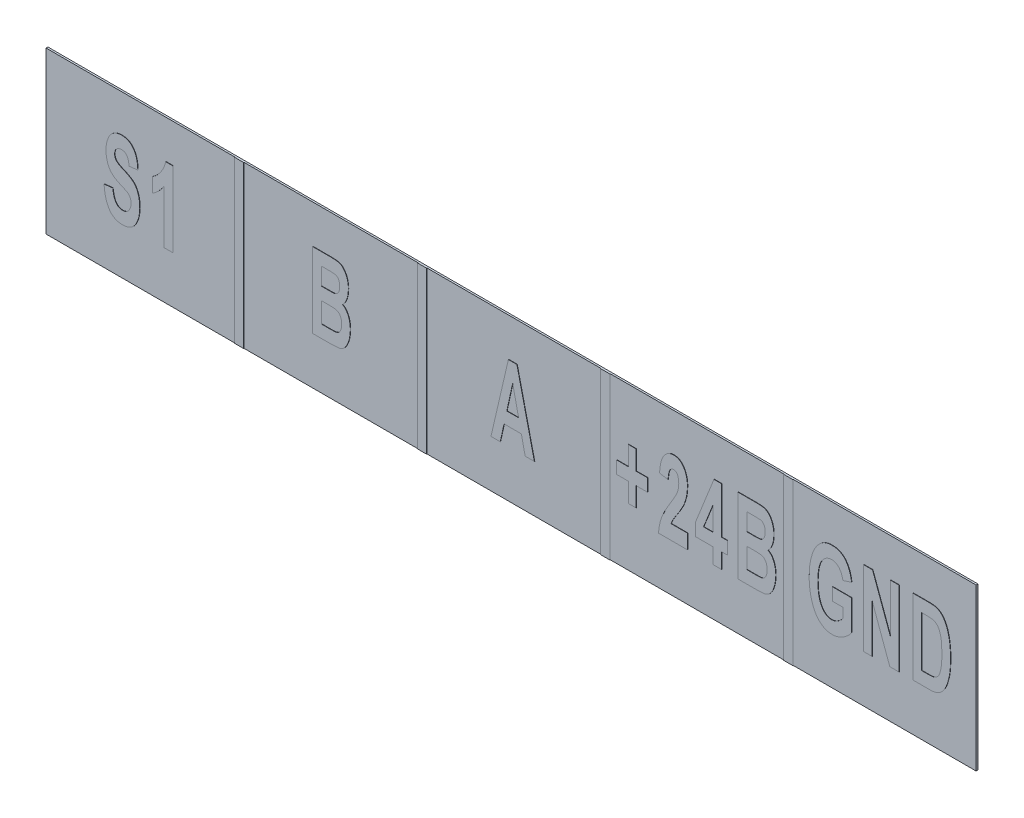
from build123d import *

# Parameters (mm, degrees)
SKETCH_1_W          = 25.4
SKETCH_1_H          = 4.4
EXTRUDE_1_DEPTH     = 0.05
EXTRUDE_START       = 0.05
EXTRUDE_3_OUTLINE_W = 0.25
EXTRUDE_3_OUTLINE_H = 4.4
EXTRUDE_3_DEPTH     = 0.01


# Read off the part's stored shape, not the designer's step: Вытянуть3
with BuildPart() as part:
    # Эскиз1 → Вытянуть1 (new body)
    with BuildSketch(Plane.XY):
        Rectangle(SKETCH_1_W, SKETCH_1_H)
    extrude(amount=EXTRUDE_1_DEPTH)

    # Вытянуть3 outline → Вытянуть3 (add)
    # profile 1 of 15: a face of its own
    with BuildSketch(Plane.XY.offset(EXTRUDE_START)):
        with BuildLine():
            add(Edge.make_bspline(
                [(-10.60971898, -0.92634173), (-10.628141935, -0.925829556), (-10.664103002, -0.924829808), (-10.716275842, -0.915836133), (-10.765314847, -0.902033064), (-10.811009529, -0.882090811), (-10.853366052, -0.856338641), (-10.892366385, -0.824740806), (-10.927796173, -0.787350875), (-10.960174583, -0.744602997), (-10.988703237, -0.696153331), (-11.014688087, -0.642754346), (-11.037904626, -0.584244003), (-11.056681607, -0.520130129), (-11.073905658, -0.451299925), (-11.087047258, -0.377132168), (-11.098049427, -0.297936445), (-11.102273788, -0.243271097), (-11.104449599, -0.215115017)],
                knots=[0, 0, 0, 0, 0.057155361, 0.111565592, 0.163872745, 0.214994054, 0.265837779, 0.317326872, 0.370350595, 0.425384155, 0.483459049, 0.544609463, 0.609628177, 0.678619213, 0.751865577, 0.829814748, 0.912343931, 1, 1, 1, 1], degree=3))
            add(Edge.make_bspline(
                [(-10.129805585, -0.296198155), (-10.130513437, -0.325045668), (-10.131907163, -0.381844994), (-10.143093873, -0.465690859), (-10.160445613, -0.54681221), (-10.185415197, -0.624018094), (-10.216181873, -0.695133324), (-10.254065021, -0.757520053), (-10.297617751, -0.81045315), (-10.347950904, -0.85333532), (-10.40448026, -0.886242611), (-10.467155779, -0.909887412), (-10.536370758, -0.924090656), (-10.584679706, -0.925573269), (-10.60971898, -0.92634173)],
                knots=[0, 0, 0, 0, 0.096838906, 0.190671015, 0.283568747, 0.375066741, 0.462729751, 0.543166375, 0.619379511, 0.691938791, 0.764001999, 0.837930566, 0.915996908, 1, 1, 1, 1], degree=3))
            add(Edge.make_bspline(
                [(-10.779293868, 0.51874912), (-10.77503929, 0.513275717), (-10.765893229, 0.50150955), (-10.748211785, 0.485372071), (-10.727234263, 0.468333121), (-10.701925465, 0.45156835), (-10.67252568, 0.434767289), (-10.639203661, 0.417660561), (-10.602154738, 0.399749555), (-10.548582165, 0.377399735), (-10.48374803, 0.349477256), (-10.414020494, 0.312832835), (-10.355144175, 0.276165261), (-10.306215425, 0.237790096), (-10.265590071, 0.19487735), (-10.230671352, 0.146106573), (-10.200463926, 0.090182725), (-10.175120504, 0.027348815), (-10.154399316, -0.042736109), (-10.139875416, -0.12035534), (-10.131285864, -0.205728213), (-10.130313262, -0.265170555), (-10.129805585, -0.296198155)],
                knots=[0, 0, 0, 0, 0.018347505, 0.03944161, 0.063240486, 0.08997119, 0.119789455, 0.152973188, 0.189249474, 0.228838423, 0.306828834, 0.376294856, 0.437438304, 0.490488661, 0.540653041, 0.593543584, 0.649040805, 0.708743837, 0.772841298, 0.842457583, 0.917766311, 1, 1, 1, 1], degree=3))
            add(Edge.make_bspline(
                [(-10.814690567, 0.640991211), (-10.814426411, 0.629413373), (-10.813914718, 0.606986141), (-10.806214605, 0.575034583), (-10.796092947, 0.544982473), (-10.784885686, 0.527481274), (-10.779293868, 0.51874912)],
                knots=[0, 0, 0, 0, 0.268069174, 0.51927224, 0.760142774, 1, 1, 1, 1], degree=3))
            add(Edge.make_bspline(
                [(-10.778882278, 0.765702839), (-10.78446552, 0.757528534), (-10.795949946, 0.74071443), (-10.80654279, 0.710632004), (-10.813904192, 0.677162152), (-10.814421094, 0.653386193), (-10.814690567, 0.640991211)],
                knots=[0, 0, 0, 0, 0.224074753, 0.460909636, 0.718959152, 1, 1, 1, 1], degree=3))
            add(Edge.make_bspline(
                [(-10.624947793, 0.838554187), (-10.64056431, 0.837767146), (-10.670665341, 0.836250116), (-10.713137808, 0.82216179), (-10.750184169, 0.798641784), (-10.769215793, 0.77679778), (-10.778882278, 0.765702839)],
                knots=[0, 0, 0, 0, 0.264588127, 0.5099969, 0.751119118, 1, 1, 1, 1], degree=3))
            add(Edge.make_bspline(
                [(-10.419564616, 0.548795156), (-10.422340104, 0.572721197), (-10.427510074, 0.617288838), (-10.440246653, 0.678708025), (-10.457510795, 0.729470787), (-10.479412307, 0.770230048), (-10.507120983, 0.801512196), (-10.541085416, 0.823430642), (-10.581207182, 0.836661264), (-10.60988702, 0.837902415), (-10.624947793, 0.838554187)],
                knots=[0, 0, 0, 0, 0.181704909, 0.338466312, 0.472385547, 0.585007184, 0.685428934, 0.784209652, 0.886681038, 1, 1, 1, 1], degree=3))
            Line((-10.419564616, 0.548795156), (-10.182489045, 0.575136886))
            add(Edge.make_bspline(
                [(-10.62782892, 1.180996678), (-10.610097651, 1.180596179), (-10.575684744, 1.17981889), (-10.525860144, 1.171690202), (-10.479248448, 1.158996696), (-10.435857294, 1.141094531), (-10.396291369, 1.117030472), (-10.359860838, 1.088526523), (-10.326561743, 1.054963946), (-10.297587598, 1.015954016), (-10.271759821, 0.972918162), (-10.248491285, 0.926415005), (-10.229488057, 0.87608601), (-10.21321786, 0.822630778), (-10.200725037, 0.765607982), (-10.190702187, 0.705198833), (-10.184621665, 0.641243967), (-10.18321087, 0.597512064), (-10.182489045, 0.575136886)],
                knots=[0, 0, 0, 0, 0.062767438, 0.121819264, 0.178302912, 0.233637247, 0.287485113, 0.341837334, 0.397171669, 0.454427963, 0.513527776, 0.574825207, 0.638370676, 0.703873085, 0.772618656, 0.845013086, 0.920701833, 1, 1, 1, 1], degree=3))
            add(Edge.make_bspline(
                [(-11.051766138, 0.613414712), (-11.051129259, 0.638964196), (-11.049874999, 0.689280868), (-11.040047297, 0.763504672), (-11.024554538, 0.835160577), (-11.002960568, 0.90363847), (-10.975644982, 0.967102488), (-10.941768538, 1.023263893), (-10.902260157, 1.071268908), (-10.857559801, 1.111435052), (-10.807053903, 1.142634059), (-10.751704765, 1.165028974), (-10.691306432, 1.178536392), (-10.64943995, 1.180159069), (-10.62782892, 1.180996678)],
                knots=[0, 0, 0, 0, 0.096380759, 0.189810457, 0.282012948, 0.372717922, 0.46034348, 0.542115107, 0.619337112, 0.694143952, 0.767842695, 0.842155281, 0.918522242, 1, 1, 1, 1], degree=3))
            add(Edge.make_bspline(
                [(-10.942283323, 0.203883127), (-10.951028151, 0.218155572), (-10.96856093, 0.246770839), (-10.990696053, 0.292418033), (-11.009869645, 0.340200295), (-11.024670834, 0.390628225), (-11.037574276, 0.44296579), (-11.045156827, 0.497871311), (-11.051039218, 0.554842236), (-11.05152074, 0.593641443), (-11.051766138, 0.613414712)],
                knots=[0, 0, 0, 0, 0.116753437, 0.234082586, 0.353564175, 0.475630413, 0.600576703, 0.729353041, 0.862069989, 1, 1, 1, 1], degree=3))
            add(Edge.make_bspline(
                [(-10.670634231, 0.002204256), (-10.68624526, 0.008977642), (-10.716670494, 0.022178683), (-10.759357867, 0.045205461), (-10.799092171, 0.068350276), (-10.834823716, 0.093185643), (-10.867433529, 0.118576633), (-10.895617659, 0.146022254), (-10.921246498, 0.173784243), (-10.935358787, 0.1939757), (-10.942283323, 0.203883127)],
                knots=[0, 0, 0, 0, 0.148753206, 0.289913688, 0.423873812, 0.550678861, 0.670231807, 0.784797709, 0.894405789, 1, 1, 1, 1], degree=3))
            add(Edge.make_bspline(
                [(-10.47801033, -0.087110673), (-10.482098293, -0.08472591), (-10.491223056, -0.07940287), (-10.507141466, -0.071830077), (-10.525941918, -0.062242603), (-10.548193943, -0.051419027), (-10.574268073, -0.040237287), (-10.603244706, -0.026785906), (-10.635996506, -0.01305456), (-10.658714548, -0.003046673), (-10.670634231, 0.002204256)],
                knots=[0, 0, 0, 0, 0.066813334, 0.149134369, 0.248786147, 0.364915066, 0.498499582, 0.649399019, 0.816046988, 1, 1, 1, 1], degree=3))
            add(Edge.make_bspline(
                [(-10.366881156, -0.300314051), (-10.367220552, -0.288640386), (-10.367878079, -0.266024518), (-10.372255268, -0.233388688), (-10.380177061, -0.203609722), (-10.390773736, -0.176031561), (-10.406188413, -0.151037782), (-10.42509658, -0.127034234), (-10.449816614, -0.105857831), (-10.468406423, -0.093496704), (-10.47801033, -0.087110673)],
                knots=[0, 0, 0, 0, 0.138309456, 0.267952563, 0.388985445, 0.502773048, 0.616502594, 0.735554804, 0.863381761, 1, 1, 1, 1], degree=3))
            add(Edge.make_bspline(
                [(-10.603956727, -0.583899239), (-10.594470906, -0.583718321), (-10.575952569, -0.583365133), (-10.549095949, -0.578975814), (-10.523815941, -0.572703651), (-10.500778892, -0.562971371), (-10.479101207, -0.551385433), (-10.459559906, -0.536520336), (-10.441673466, -0.519136082), (-10.420837161, -0.492417497), (-10.399593751, -0.455187878), (-10.380161763, -0.406970254), (-10.368901475, -0.3547461), (-10.367565498, -0.31875182), (-10.366881156, -0.300314051)],
                knots=[0, 0, 0, 0, 0.068384962, 0.133501975, 0.195944322, 0.255887312, 0.313495041, 0.3729041, 0.432420328, 0.493038273, 0.616838825, 0.740397606, 0.867020844, 1, 1, 1, 1], degree=3))
            add(Edge.make_bspline(
                [(-10.867374028, -0.188773287), (-10.865446825, -0.205254838), (-10.861727618, -0.237061708), (-10.854214471, -0.282903591), (-10.845791381, -0.325421842), (-10.835437086, -0.364538178), (-10.823969207, -0.400423465), (-10.811344877, -0.433148247), (-10.797011672, -0.462346193), (-10.78130075, -0.488116659), (-10.764300562, -0.510687947), (-10.745695456, -0.530227035), (-10.725427767, -0.546689826), (-10.704004108, -0.560496736), (-10.680947017, -0.570895511), (-10.656587403, -0.578234527), (-10.630750738, -0.582935956), (-10.613032314, -0.583572959), (-10.603956727, -0.583899239)],
                knots=[0, 0, 0, 0, 0.094941404, 0.183222381, 0.265748011, 0.342868784, 0.414619948, 0.481244495, 0.543389025, 0.600478157, 0.653706747, 0.704790541, 0.754448857, 0.802799152, 0.850229264, 0.898655983, 0.948090387, 1, 1, 1, 1], degree=3))
            Line((-10.867374028, -0.188773287), (-11.104449599, -0.215115017))
        make_face()
    # profile 2 of 15: a face of its own
    with BuildSketch(Plane.XY.offset(EXTRUDE_START)):
        with BuildLine():
            add(Edge.make_bspline(
                [(-9.779460574, 0.627820346), (-9.763118314, 0.637840247), (-9.727908667, 0.659428277), (-9.677822987, 0.703228822), (-9.625359182, 0.757683125), (-9.57212639, 0.822249295), (-9.521375014, 0.895340583), (-9.478881734, 0.976169038), (-9.445062086, 1.062930173), (-9.429909929, 1.123724295), (-9.42220086, 1.154654948)],
                knots=[0, 0, 0, 0, 0.087928692, 0.189443698, 0.304433758, 0.435158803, 0.573433564, 0.712420315, 0.853686061, 1, 1, 1, 1], degree=3))
            Line((-9.779460574, 0.627820346), (-9.779460574, 0.232694394))
            add(Edge.make_bspline(
                [(-9.463359813, 0.5627892), (-9.474535942, 0.544677481), (-9.49651076, 0.50906571), (-9.532618667, 0.45880128), (-9.569788617, 0.411915344), (-9.608790578, 0.36884633), (-9.648994626, 0.329312983), (-9.690852526, 0.293390024), (-9.733791137, 0.260484563), (-9.764331106, 0.24190078), (-9.779460574, 0.232694394)],
                knots=[0, 0, 0, 0, 0.138234037, 0.271799642, 0.401820386, 0.526777454, 0.649060785, 0.767883963, 0.885009964, 1, 1, 1, 1], degree=3))
            Line((-9.463359813, 0.5627892), (-9.463359813, -0.9))
            Line((-9.463359813, -0.9), (-9.226284242, -0.9))
            Line((-9.226284242, -0.9), (-9.226284242, 1.154654948))
            Line((-9.226284242, 1.154654948), (-9.42220086, 1.154654948))
        make_face()
    # profile 3 of 15: a face of its own
    with BuildSketch(Plane.XY.offset(EXTRUDE_START)):
        with BuildLine():
            add(Edge.make_bspline(
                [(8.761184819, -0.583899239), (8.775104898, -0.583268092), (8.803287987, -0.581990248), (8.845282993, -0.57124279), (8.887631799, -0.555474284), (8.928578399, -0.531876036), (8.968617762, -0.50476919), (9.005718739, -0.473793222), (9.040636409, -0.440812544), (9.060924159, -0.416329084), (9.071111737, -0.404034613)],
                knots=[0, 0, 0, 0, 0.112823504, 0.22842649, 0.350030893, 0.478633326, 0.610830397, 0.742147478, 0.870518282, 1, 1, 1, 1], degree=3))
            add(Edge.make_bspline(
                [(8.386226754, 0.151199667), (8.386508621, 0.121556291), (8.387055808, 0.064009784), (8.392226937, -0.019317988), (8.399556411, -0.097013127), (8.411331865, -0.168804981), (8.425404245, -0.235160828), (8.442942439, -0.29577254), (8.463953242, -0.350623148), (8.48825698, -0.399560319), (8.514737868, -0.443154299), (8.544369422, -0.480274367), (8.574987194, -0.512534277), (8.608471564, -0.538280531), (8.643632949, -0.558852607), (8.68101811, -0.573252105), (8.720413552, -0.582362762), (8.74741456, -0.583380303), (8.761184819, -0.583899239)],
                knots=[0, 0, 0, 0, 0.097537687, 0.18934933, 0.274661063, 0.35423026, 0.428617281, 0.497766892, 0.561656542, 0.621624347, 0.67737875, 0.729134482, 0.777664497, 0.823360586, 0.867656858, 0.911255069, 0.954740925, 1, 1, 1, 1], degree=3))
            add(Edge.make_bspline(
                [(8.771062968, 0.838554187), (8.756762031, 0.837946197), (8.728630553, 0.836750217), (8.687391334, 0.828894902), (8.648469935, 0.815186866), (8.611885663, 0.796049544), (8.577656526, 0.771380715), (8.546124332, 0.740976619), (8.516129473, 0.705774599), (8.489066654, 0.664810674), (8.464972309, 0.618506289), (8.443297506, 0.567302293), (8.426031313, 0.510486194), (8.411024881, 0.44884694), (8.400311079, 0.38178079), (8.392027859, 0.309696053), (8.387105387, 0.232213668), (8.38652591, 0.178783209), (8.386226754, 0.151199667)],
                knots=[0, 0, 0, 0, 0.048933012, 0.096256492, 0.143024873, 0.189639857, 0.237063355, 0.286873488, 0.339167922, 0.395024291, 0.454451604, 0.51757441, 0.58498224, 0.657398995, 0.734498521, 0.817186613, 0.905622359, 1, 1, 1, 1], degree=3))
            add(Edge.make_bspline(
                [(9.071111737, 0.496111695), (9.065943949, 0.521372414), (9.056049373, 0.569738194), (9.03233948, 0.637084091), (9.002795594, 0.696269519), (8.972555693, 0.739011426), (8.945650208, 0.768400293), (8.924438709, 0.787196344), (8.901894109, 0.803272404), (8.877897162, 0.815736567), (8.853169657, 0.826493107), (8.826753896, 0.833186435), (8.7993714, 0.838087161), (8.780552616, 0.838397629), (8.771062968, 0.838554187)],
                knots=[0, 0, 0, 0, 0.155460721, 0.297654997, 0.429478997, 0.55354701, 0.612141232, 0.669625123, 0.724297239, 0.778749472, 0.832568518, 0.886597336, 0.942815039, 1, 1, 1, 1], degree=3))
            Line((9.071111737, 0.496111695), (9.308187308, 0.575136886))
            add(Edge.make_bspline(
                [(8.773120915, 1.180996678), (8.792076726, 1.180532815), (8.82917875, 1.179624901), (8.883304899, 1.17222391), (8.934206479, 1.159422445), (8.981882928, 1.141701976), (9.026254016, 1.118934983), (9.067296077, 1.091155051), (9.105138821, 1.058252462), (9.139520981, 1.020332797), (9.170821248, 0.977905562), (9.199689593, 0.931931786), (9.22522448, 0.881716108), (9.247774512, 0.827740136), (9.267470753, 0.769966212), (9.284406968, 0.708566182), (9.297880593, 0.643201913), (9.304691845, 0.598220749), (9.308187308, 0.575136886)],
                knots=[0, 0, 0, 0, 0.06346924, 0.124227724, 0.182512098, 0.23892629, 0.294206336, 0.349133886, 0.404505518, 0.4617482, 0.520195354, 0.580882562, 0.643354336, 0.708637207, 0.776641421, 0.847649778, 0.921815458, 1, 1, 1, 1], degree=3))
            add(Edge.make_bspline(
                [(8.472248967, 1.079334063), (8.482521077, 1.087508079), (8.502929536, 1.103748078), (8.536325849, 1.124280909), (8.571131181, 1.142185905), (8.608129368, 1.156019186), (8.646642574, 1.167202695), (8.687058846, 1.175614587), (8.729534355, 1.179937954), (8.758432522, 1.180639895), (8.773120915, 1.180996678)],
                knots=[0, 0, 0, 0, 0.121324888, 0.241046293, 0.361932344, 0.482838376, 0.605732726, 0.73266254, 0.864117405, 1, 1, 1, 1], degree=3))
            add(Edge.make_bspline(
                [(8.149151184, 0.134324496), (8.149327859, 0.160536496), (8.14967589, 0.212171011), (8.154238354, 0.288461858), (8.159973411, 0.362517194), (8.169282109, 0.434284015), (8.180545297, 0.503974176), (8.195194988, 0.571289123), (8.211411502, 0.636655158), (8.230803307, 0.699384964), (8.252344923, 0.75940322), (8.276837652, 0.815885795), (8.302983317, 0.869122455), (8.331707377, 0.918607541), (8.363246007, 0.964174692), (8.397098783, 1.006236764), (8.432977668, 1.045118904), (8.459277353, 1.068032531), (8.472248967, 1.079334063)],
                knots=[0, 0, 0, 0, 0.076396793, 0.150492572, 0.222730197, 0.292872716, 0.361382919, 0.4284491, 0.493632188, 0.557644101, 0.61976273, 0.679418602, 0.73701047, 0.79257106, 0.846042683, 0.898383624, 0.94988045, 1, 1, 1, 1], degree=3))
            add(Edge.make_bspline(
                [(8.77805999, -0.92634173), (8.762125935, -0.925951608), (8.730684312, -0.925181807), (8.684199397, -0.91888923), (8.639278321, -0.908177924), (8.595970445, -0.893184579), (8.55400501, -0.874750815), (8.513829675, -0.851394397), (8.475332906, -0.82371739), (8.438054785, -0.792459319), (8.403143922, -0.756861373), (8.370267901, -0.717781996), (8.339592369, -0.675200664), (8.311762828, -0.628695391), (8.285249252, -0.579008455), (8.261538213, -0.525428467), (8.240132776, -0.468347155), (8.214265616, -0.387105587), (8.188087726, -0.28017598), (8.165552418, -0.146888144), (8.151630091, -0.008107162), (8.149987482, 0.086272948), (8.149151184, 0.134324496)],
                knots=[0, 0, 0, 0, 0.034900339, 0.068866545, 0.102549606, 0.13591464, 0.169150796, 0.202817758, 0.237515579, 0.272923526, 0.309269569, 0.346601563, 0.384723865, 0.424108648, 0.465253795, 0.508042701, 0.552370714, 0.598760379, 0.694773461, 0.79326019, 0.894742991, 1, 1, 1, 1], degree=3))
            add(Edge.make_bspline(
                [(9.308187308, -0.618884349), (9.294180927, -0.639074822), (9.26565874, -0.680190116), (9.211538631, -0.735106932), (9.150265715, -0.787756619), (9.080956063, -0.834905768), (9.007383506, -0.874918008), (8.931714933, -0.904908488), (8.855045491, -0.922874886), (8.803530597, -0.925194727), (8.77805999, -0.92634173)],
                knots=[0, 0, 0, 0, 0.115778008, 0.235766976, 0.362535251, 0.496694809, 0.630538361, 0.757033491, 0.879869603, 1, 1, 1, 1], degree=3))
            Line((9.308187308, -0.618884349), (9.308187308, 0.206352664))
            Line((9.308187308, 0.206352664), (8.781352706, 0.206352664))
            Line((8.781352706, 0.206352664), (8.781352706, -0.136089827))
            Line((8.781352706, -0.136089827), (9.071111737, -0.136089827))
            Line((9.071111737, -0.136089827), (9.071111737, -0.404034613))
        make_face()
    # profile 4 of 15: a face of its own
    with BuildSketch(Plane.XY.offset(EXTRUDE_START)):
        with BuildLine():
            add(Edge.make_bspline(
                [(11.667994736, -0.85637151), (11.653345761, -0.863138566), (11.622684126, -0.877302629), (11.5706254, -0.890241871), (11.512135344, -0.898484542), (11.470739604, -0.899478636), (11.449029104, -0.9)],
                knots=[0, 0, 0, 0, 0.214501474, 0.448971073, 0.711006174, 1, 1, 1, 1], degree=3))
            add(Edge.make_bspline(
                [(11.842097108, -0.692558875), (11.830870392, -0.709354832), (11.808514727, -0.742800479), (11.767285175, -0.78696782), (11.720373763, -0.825360958), (11.685572702, -0.845964626), (11.667994736, -0.85637151)],
                knots=[0, 0, 0, 0, 0.25040702, 0.498633385, 0.74676044, 1, 1, 1, 1], degree=3))
            add(Edge.make_bspline(
                [(11.973394169, -0.329536907), (11.965435186, -0.365217243), (11.950141686, -0.433778418), (11.919448895, -0.52998845), (11.885307414, -0.616453743), (11.856114801, -0.667869895), (11.842097108, -0.692558875)],
                knots=[0, 0, 0, 0, 0.282649147, 0.54312151, 0.780616334, 1, 1, 1, 1], degree=3))
            add(Edge.make_bspline(
                [(12.010848816, 0.107571176), (12.010391504, 0.066810742), (12.009508497, -0.01189212), (12.002308273, -0.125582891), (11.991583246, -0.230827412), (11.979298527, -0.297494809), (11.973394169, -0.329536907)],
                knots=[0, 0, 0, 0, 0.278274174, 0.537309619, 0.777618872, 1, 1, 1, 1], degree=3))
            add(Edge.make_bspline(
                [(11.668817915, 1.115553942), (11.686537925, 1.10561153), (11.722963515, 1.085173717), (11.770886201, 1.041301084), (11.815930185, 0.98860275), (11.855570669, 0.925193086), (11.891676588, 0.853512177), (11.923349087, 0.77376709), (11.949776897, 0.686244612), (11.967961188, 0.608284587), (11.980417295, 0.541805963), (11.988605886, 0.488264693), (11.995526751, 0.431848564), (12.001441603, 0.372579128), (12.005188351, 0.310369241), (12.008813804, 0.2453541), (12.010152301, 0.177409031), (12.010613469, 0.131168878), (12.010848816, 0.107571176)],
                knots=[0, 0, 0, 0, 0.054716942, 0.112477188, 0.174252007, 0.241578543, 0.313830535, 0.390827753, 0.472993245, 0.560536587, 0.606903899, 0.6556418, 0.706796134, 0.760406544, 0.816481765, 0.875103254, 0.936261539, 1, 1, 1, 1], degree=3))
            add(Edge.make_bspline(
                [(11.435858239, 1.154654948), (11.459901865, 1.154288109), (11.50496267, 1.153600608), (11.567938514, 1.145857564), (11.62253296, 1.135328538), (11.654160834, 1.121815974), (11.668817915, 1.115553942)],
                knots=[0, 0, 0, 0, 0.302833063, 0.567547568, 0.799591657, 1, 1, 1, 1], degree=3))
            Line((11.435858239, 1.154654948), (10.983521342, 1.154654948))
            Line((10.983521342, 1.154654948), (10.983521342, -0.9))
            Line((10.983521342, -0.9), (11.449029104, -0.9))
        make_face()
        with BuildLine():
            add(Edge.make_bspline(
                [(11.415690352, -0.557557509), (11.432714902, -0.557372275), (11.464204028, -0.557029662), (11.507502641, -0.553349489), (11.543432278, -0.547899122), (11.564063502, -0.540930757), (11.573329143, -0.537801211)],
                knots=[0, 0, 0, 0, 0.319773085, 0.591462045, 0.816522471, 1, 1, 1, 1], degree=3))
            Line((11.415690352, -0.557557509), (11.220596913, -0.557557509))
            Line((11.220596913, -0.557557509), (11.220596913, 0.812212457))
            Line((11.220596913, 0.812212457), (11.33789993, 0.812212457))
            add(Edge.make_bspline(
                [(11.552338077, 0.792456159), (11.547280765, 0.794032784), (11.536183884, 0.797492255), (11.517484535, 0.801578937), (11.495441659, 0.804566201), (11.470216332, 0.807629908), (11.441770524, 0.809427473), (11.410086089, 0.811234592), (11.375082145, 0.811870862), (11.350659002, 0.812095238), (11.33789993, 0.812212457)],
                knots=[0, 0, 0, 0, 0.073524573, 0.161329492, 0.265308941, 0.382261587, 0.514034373, 0.660898358, 0.82284744, 1, 1, 1, 1], degree=3))
            add(Edge.make_bspline(
                [(11.773773246, 0.126504295), (11.77369986, 0.14598694), (11.773557724, 0.183721603), (11.7723093, 0.238470592), (11.770303642, 0.289657229), (11.767384103, 0.337406321), (11.763963915, 0.381781912), (11.758731005, 0.422616923), (11.753666669, 0.460011822), (11.745521928, 0.504057768), (11.733820689, 0.553781782), (11.716857913, 0.607555227), (11.697098191, 0.654430009), (11.674471057, 0.694257033), (11.648989945, 0.728188595), (11.620120101, 0.755860603), (11.587942627, 0.778088237), (11.564214489, 0.787663531), (11.552338077, 0.792456159)],
                knots=[0, 0, 0, 0, 0.07874111, 0.152508516, 0.221322528, 0.285761665, 0.345855363, 0.401152776, 0.45212467, 0.49834825, 0.582138486, 0.658420186, 0.725987461, 0.787336938, 0.843121513, 0.896850925, 0.948371808, 1, 1, 1, 1], degree=3))
            add(Edge.make_bspline(
                [(11.573329143, -0.537801211), (11.583644933, -0.53317102), (11.604322868, -0.523889831), (11.632498515, -0.504306385), (11.657289365, -0.479880469), (11.68039435, -0.451074788), (11.70110122, -0.414742051), (11.718566359, -0.369123047), (11.734494234, -0.314027322), (11.74550808, -0.261835715), (11.753621496, -0.214947298), (11.758729202, -0.175368091), (11.763905419, -0.132742668), (11.767392215, -0.086867464), (11.770287066, -0.038019026), (11.772303904, 0.013989401), (11.773554928, 0.069149885), (11.773699085, 0.107021671), (11.773773246, 0.126504295)],
                knots=[0, 0, 0, 0, 0.046372104, 0.092952592, 0.139977472, 0.188908462, 0.244195236, 0.310955801, 0.389057774, 0.479578964, 0.529882699, 0.584472997, 0.643466421, 0.706220821, 0.773393917, 0.844451518, 0.919980205, 1, 1, 1, 1], degree=3))
        make_face(mode=Mode.SUBTRACT)
    # profile 5 of 15: a face of its own
    with BuildSketch(Plane.XY.offset(EXTRUDE_START)):
        with BuildLine():
            add(Edge.make_bspline(
                [(4.710968825, 0.080406267), (4.707302139, 0.072568278), (4.699527532, 0.055949107), (4.686367217, 0.02992205), (4.670489922, 0.001796919), (4.653474881, -0.029470981), (4.632954106, -0.062364047), (4.611493184, -0.09842306), (4.586808451, -0.136230519), (4.561343021, -0.175774951), (4.535946737, -0.214867618), (4.512156788, -0.251235721), (4.49094048, -0.284164897), (4.473102347, -0.31400062), (4.456878332, -0.33965851), (4.44366267, -0.362081951), (4.432864499, -0.380969793), (4.417590111, -0.410184134), (4.398400827, -0.450531794), (4.385514197, -0.487056202), (4.379227661, -0.504874048)],
                knots=[0, 0, 0, 0, 0.038502239, 0.081637693, 0.129724339, 0.182198611, 0.239989059, 0.302177609, 0.368896169, 0.440859975, 0.511467207, 0.57631637, 0.634232425, 0.685742667, 0.730974039, 0.76929194, 0.801547998, 0.827762044, 0.915976475, 1, 1, 1, 1], degree=3))
            add(Edge.make_bspline(
                [(4.825802305, 0.595716362), (4.825530997, 0.573341532), (4.824994237, 0.529074709), (4.819359019, 0.463549008), (4.810817837, 0.399653151), (4.798757277, 0.336846575), (4.782984165, 0.274174823), (4.763002634, 0.210631712), (4.739285486, 0.145582019), (4.720525496, 0.102402618), (4.710968825, 0.080406267)],
                knots=[0, 0, 0, 0, 0.1261159, 0.249510287, 0.370495697, 0.489426299, 0.609864041, 0.7346326, 0.864817157, 1, 1, 1, 1], degree=3))
            add(Edge.make_bspline(
                [(4.452490598, 1.154654948), (4.466649496, 1.154180815), (4.49448214, 1.153248794), (4.535035078, 1.145910774), (4.572906475, 1.132732462), (4.608825141, 1.115448593), (4.642218081, 1.092678257), (4.673051223, 1.064545676), (4.701324422, 1.03152218), (4.727066521, 0.993958369), (4.750357024, 0.953082035), (4.770636084, 0.909302545), (4.787235206, 0.862877953), (4.80204389, 0.814408726), (4.812361918, 0.76308208), (4.820334226, 0.709524557), (4.82477907, 0.653413664), (4.825456675, 0.615205447), (4.825802305, 0.595716362)],
                knots=[0, 0, 0, 0, 0.056704136, 0.111465314, 0.1643007, 0.216901171, 0.270710877, 0.325574003, 0.383636199, 0.444465096, 0.507725717, 0.571905955, 0.637455252, 0.705099969, 0.774731586, 0.84693785, 0.92192671, 1, 1, 1, 1], degree=3))
            add(Edge.make_bspline(
                [(4.061892132, 0.534801111), (4.063863889, 0.561438254), (4.06767249, 0.612889935), (4.076806146, 0.687037363), (4.088002613, 0.75539772), (4.102422626, 0.817958526), (4.119528438, 0.874652565), (4.139158172, 0.925528199), (4.161424352, 0.970583115), (4.186564097, 1.00981822), (4.214116605, 1.043965001), (4.243121758, 1.073581485), (4.273865758, 1.098670511), (4.306384331, 1.119036571), (4.340418338, 1.135281658), (4.376507929, 1.146287761), (4.413905975, 1.15371743), (4.439557679, 1.154340708), (4.452490598, 1.154654948)],
                knots=[0, 0, 0, 0, 0.098731803, 0.190708037, 0.27609336, 0.354711731, 0.427875905, 0.494844219, 0.55608801, 0.613350504, 0.666739676, 0.718027581, 0.766347984, 0.813068672, 0.859582416, 0.905301234, 0.952255355, 1, 1, 1, 1], degree=3))
            Line((4.061892132, 0.534801111), (4.298967702, 0.496111695))
            add(Edge.make_bspline(
                [(4.447551524, 0.812212457), (4.437111578, 0.811356944), (4.416261709, 0.809648379), (4.386971597, 0.794997891), (4.362347111, 0.770609448), (4.345343678, 0.744177485), (4.333817608, 0.718570738), (4.325447784, 0.69579989), (4.318770338, 0.669815878), (4.312455986, 0.641023844), (4.307734291, 0.609098361), (4.303524368, 0.57425427), (4.300788099, 0.536202099), (4.299590804, 0.509834199), (4.298967702, 0.496111695)],
                knots=[0, 0, 0, 0, 0.081508014, 0.162781635, 0.250249408, 0.350457412, 0.407233293, 0.470161852, 0.54032682, 0.617304432, 0.701099631, 0.793127913, 0.892338682, 1, 1, 1, 1], degree=3))
            add(Edge.make_bspline(
                [(4.588726734, 0.542621313), (4.588290211, 0.563087322), (4.587469899, 0.601547028), (4.580527752, 0.655496237), (4.569443688, 0.702158567), (4.553246315, 0.74130269), (4.532521889, 0.772357321), (4.508452333, 0.796092695), (4.478913961, 0.809512117), (4.45809995, 0.811304226), (4.447551524, 0.812212457)],
                knots=[0, 0, 0, 0, 0.182319056, 0.342613796, 0.483762358, 0.608661945, 0.717852868, 0.814741715, 0.906112121, 1, 1, 1, 1], degree=3))
            add(Edge.make_bspline(
                [(4.543040295, 0.305134152), (4.550177421, 0.325041093), (4.564171578, 0.364073737), (4.577825269, 0.424032291), (4.587066179, 0.483337867), (4.58817623, 0.522967784), (4.588726734, 0.542621313)],
                knots=[0, 0, 0, 0, 0.260732058, 0.511231796, 0.757606874, 1, 1, 1, 1], degree=3))
            add(Edge.make_bspline(
                [(4.359882953, -0.026607011), (4.371669816, -0.006980748), (4.394165396, 0.030476561), (4.426565782, 0.084000645), (4.454892564, 0.132894904), (4.479476294, 0.176861839), (4.500828023, 0.215647055), (4.517908476, 0.249854506), (4.532228667, 0.278883177), (4.539691505, 0.297003183), (4.543040295, 0.305134152)],
                knots=[0, 0, 0, 0, 0.181089318, 0.345614366, 0.494894749, 0.628023864, 0.744081917, 0.845031045, 0.930460959, 1, 1, 1, 1], degree=3))
            add(Edge.make_bspline(
                [(4.035550401, -0.9), (4.038268509, -0.866340138), (4.04365971, -0.799577839), (4.059363857, -0.701053383), (4.081963922, -0.60537964), (4.105079371, -0.526582741), (4.128858373, -0.462929916), (4.150265238, -0.4113797), (4.175973268, -0.356338), (4.205245321, -0.297485905), (4.238163749, -0.234821003), (4.275358802, -0.168696624), (4.316060985, -0.09868727), (4.344982655, -0.051115663), (4.359882953, -0.026607011)],
                knots=[0, 0, 0, 0, 0.107424949, 0.213070889, 0.317057734, 0.420087173, 0.474094216, 0.533196345, 0.597652142, 0.667349875, 0.742334839, 0.822855489, 0.908736042, 1, 1, 1, 1], degree=3))
            Line((4.035550401, -0.9), (4.825802305, -0.9))
            Line((4.825802305, -0.9), (4.825802305, -0.504874048))
            Line((4.825802305, -0.504874048), (4.379227661, -0.504874048))
        make_face()
    # profile 6 of 15: a face of its own
    with BuildSketch(Plane.XY.offset(EXTRUDE_START)):
        with BuildLine():
            add(Edge.make_bspline(
                [(6.927543095, -0.886005956), (6.921510982, -0.886864136), (6.907558316, -0.888849163), (6.883814198, -0.89125859), (6.854561711, -0.893117977), (6.820000508, -0.895298663), (6.779929173, -0.896881265), (6.734371008, -0.89795811), (6.683339307, -0.899349383), (6.647525993, -0.899776057), (6.628729094, -0.9)],
                knots=[0, 0, 0, 0, 0.061064748, 0.14124669, 0.239121224, 0.354834825, 0.488333758, 0.641026591, 0.811589998, 1, 1, 1, 1], degree=3))
            add(Edge.make_bspline(
                [(7.238704782, -0.304429946), (7.238253679, -0.327639144), (7.237357163, -0.373764737), (7.229407313, -0.442474873), (7.217935822, -0.510424918), (7.200429666, -0.576279531), (7.180127045, -0.638715582), (7.155592419, -0.695389896), (7.126970572, -0.745351748), (7.095082334, -0.788724721), (7.059516532, -0.825450603), (7.019242115, -0.853750952), (6.9752006, -0.875075927), (6.943514047, -0.882343092), (6.927543095, -0.886005956)],
                knots=[0, 0, 0, 0, 0.097901707, 0.194568299, 0.291556809, 0.38844505, 0.481813511, 0.568400634, 0.648538747, 0.72426428, 0.795086312, 0.863194303, 0.931045915, 1, 1, 1, 1], degree=3))
            add(Edge.make_bspline(
                [(7.023855046, 0.191947031), (7.040668948, 0.18189949), (7.07469687, 0.161565309), (7.117675371, 0.118081317), (7.154572895, 0.065802673), (7.185127788, 0.004652427), (7.2091175, -0.064006506), (7.226123019, -0.139132715), (7.237180088, -0.21986302), (7.238187115, -0.27571766), (7.238704782, -0.304429946)],
                knots=[0, 0, 0, 0, 0.103320918, 0.209100551, 0.320526909, 0.441009579, 0.5696231, 0.704549275, 0.848122452, 1, 1, 1, 1], degree=3))
            add(Edge.make_bspline(
                [(7.186021322, 0.637698495), (7.185404307, 0.614083688), (7.18419553, 0.567820582), (7.176559436, 0.499676233), (7.162280819, 0.43479473), (7.143837652, 0.373311678), (7.120209834, 0.317277317), (7.092666437, 0.267775668), (7.06126705, 0.225327792), (7.036046099, 0.202824465), (7.023855046, 0.191947031)],
                knots=[0, 0, 0, 0, 0.145032941, 0.284129975, 0.420294955, 0.552481601, 0.677824284, 0.792882665, 0.899885683, 1, 1, 1, 1], degree=3))
            add(Edge.make_bspline(
                [(6.705284747, 1.154654948), (6.72820006, 1.154433221), (6.771046976, 1.154018639), (6.830588036, 1.150672425), (6.880803088, 1.144199683), (6.923034689, 1.135359459), (6.959954668, 1.122165422), (6.99340302, 1.103313552), (7.025110217, 1.07918663), (7.054251498, 1.049009537), (7.081885647, 1.014189955), (7.106646568, 0.973541679), (7.129167606, 0.927798463), (7.149212753, 0.87707696), (7.165637673, 0.82203624), (7.17753056, 0.763514766), (7.184593325, 0.701667888), (7.185537004, 0.659394269), (7.186021322, 0.637698495)],
                knots=[0, 0, 0, 0, 0.084018191, 0.157096714, 0.218492166, 0.269506114, 0.315017773, 0.361628109, 0.409718675, 0.460583605, 0.515026273, 0.572399431, 0.634713253, 0.701781356, 0.772125315, 0.845028774, 0.920465273, 1, 1, 1, 1], degree=3))
            Line((6.705284747, 1.154654948), (6.211377308, 1.154654948))
            Line((6.211377308, 1.154654948), (6.211377308, -0.9))
            Line((6.211377308, -0.9), (6.628729094, -0.9))
        make_face()
        with BuildLine():
            add(Edge.make_bspline(
                [(6.690467524, -0.557557509), (6.701719194, -0.55765033), (6.723128518, -0.557826948), (6.753711212, -0.556638132), (6.781047428, -0.556260943), (6.805167785, -0.554291552), (6.825911649, -0.552849448), (6.843543496, -0.550944183), (6.857800591, -0.548060715), (6.866225066, -0.545792995), (6.86992056, -0.544798233)],
                knots=[0, 0, 0, 0, 0.187114811, 0.356036179, 0.508990771, 0.641654641, 0.75838832, 0.854904358, 0.936352095, 1, 1, 1, 1], degree=3))
            Line((6.690467524, -0.557557509), (6.448452879, -0.557557509))
            Line((6.448452879, -0.557557509), (6.448452879, -0.004381177))
            Line((6.448452879, -0.004381177), (6.659598309, -0.004381177))
            add(Edge.make_bspline(
                [(7.001629211, -0.286731596), (7.001359189, -0.271762141), (7.00083707, -0.242816888), (6.995568377, -0.20126632), (6.986413399, -0.163368422), (6.974213426, -0.129014888), (6.958647613, -0.098531779), (6.940097461, -0.071852658), (6.9175058, -0.050398313), (6.896000177, -0.035588182), (6.875543951, -0.026220448), (6.856191247, -0.020219525), (6.832868899, -0.015451177), (6.805793417, -0.011426037), (6.774755907, -0.008206387), (6.739895751, -0.005694247), (6.701038483, -0.004621439), (6.673867042, -0.004463904), (6.659598309, -0.004381177)],
                knots=[0, 0, 0, 0, 0.085572963, 0.165465685, 0.238916023, 0.308156283, 0.373419862, 0.434160061, 0.492974776, 0.550637497, 0.582583027, 0.621289012, 0.66622091, 0.718591857, 0.777766522, 0.844618777, 0.918403552, 1, 1, 1, 1], degree=3))
            add(Edge.make_bspline(
                [(6.86992056, -0.544798233), (6.879465406, -0.541391463), (6.898697002, -0.534527272), (6.924104546, -0.515925378), (6.946661836, -0.491849614), (6.966525186, -0.461929126), (6.982383444, -0.425899573), (6.993857244, -0.384330979), (7.000172114, -0.3372743), (7.001126354, -0.304174324), (7.001629211, -0.286731596)],
                knots=[0, 0, 0, 0, 0.097573563, 0.196597781, 0.300776823, 0.415591324, 0.542092849, 0.679878427, 0.831305207, 1, 1, 1, 1], degree=3))
        make_face(mode=Mode.SUBTRACT)
        with BuildLine():
            add(Edge.make_bspline(
                [(6.618027766, 0.338061315), (6.630101369, 0.338016224), (6.653014642, 0.337930651), (6.68552815, 0.338500639), (6.714345101, 0.338758183), (6.739596744, 0.339551604), (6.761269927, 0.340823878), (6.77937325, 0.342099276), (6.793967884, 0.343088912), (6.80242589, 0.344459182), (6.806124183, 0.345058337)],
                knots=[0, 0, 0, 0, 0.192284049, 0.364916514, 0.517885341, 0.65124477, 0.767237583, 0.863602819, 0.94035985, 1, 1, 1, 1], degree=3))
            Line((6.618027766, 0.338061315), (6.448452879, 0.338061315))
            Line((6.448452879, 0.338061315), (6.448452879, 0.812212457))
            Line((6.448452879, 0.812212457), (6.5970367, 0.812212457))
            add(Edge.make_bspline(
                [(6.818471869, 0.805215435), (6.814498853, 0.805815889), (6.80521729, 0.807218642), (6.788839718, 0.808191364), (6.767991984, 0.80945512), (6.742476267, 0.810736919), (6.71256054, 0.811508858), (6.678119661, 0.811778452), (6.639157485, 0.81234249), (6.611579784, 0.812257353), (6.5970367, 0.812212457)],
                knots=[0, 0, 0, 0, 0.054354162, 0.126979491, 0.221835021, 0.337085277, 0.472675442, 0.626792961, 0.803189501, 1, 1, 1, 1], degree=3))
            add(Edge.make_bspline(
                [(6.948945751, 0.578429602), (6.948603281, 0.593684104), (6.947952193, 0.622685316), (6.941661341, 0.663977666), (6.931724227, 0.700814864), (6.917174315, 0.732843647), (6.899227028, 0.760409116), (6.876151928, 0.781752917), (6.848884234, 0.797223322), (6.82878959, 0.802504025), (6.818471869, 0.805215435)],
                knots=[0, 0, 0, 0, 0.160407507, 0.304959939, 0.438417443, 0.560523166, 0.673838102, 0.782121385, 0.888128861, 1, 1, 1, 1], degree=3))
            add(Edge.make_bspline(
                [(6.806124183, 0.345058337), (6.816849964, 0.347760037), (6.837908165, 0.353064355), (6.866661914, 0.368876471), (6.891310958, 0.390819936), (6.912041211, 0.418622087), (6.928837307, 0.451558354), (6.940718469, 0.489670101), (6.947593806, 0.532494471), (6.948480611, 0.562625523), (6.948945751, 0.578429602)],
                knots=[0, 0, 0, 0, 0.110969925, 0.217870098, 0.326469173, 0.440807458, 0.564940908, 0.6968277, 0.840982688, 1, 1, 1, 1], degree=3))
        make_face(mode=Mode.SUBTRACT)
    # profile 7 of 15: a face of its own
    with BuildSketch(Plane.XY.offset(EXTRUDE_START)):
        with BuildLine():
            add(Edge.make_bspline(
                [(-4.69115622, -0.886005956), (-4.697188333, -0.886864136), (-4.711140998, -0.888849163), (-4.734885117, -0.89125859), (-4.764137604, -0.893117977), (-4.798698807, -0.895298663), (-4.838770141, -0.896881265), (-4.884328307, -0.89795811), (-4.935360007, -0.899349383), (-4.971173322, -0.899776057), (-4.989970221, -0.9)],
                knots=[0, 0, 0, 0, 0.061064748, 0.14124669, 0.239121224, 0.354834825, 0.488333758, 0.641026591, 0.811589998, 1, 1, 1, 1], degree=3))
            add(Edge.make_bspline(
                [(-4.379994533, -0.304429946), (-4.380445636, -0.327639144), (-4.381342152, -0.373764737), (-4.389292002, -0.442474873), (-4.400763493, -0.510424918), (-4.418269648, -0.576279531), (-4.438572269, -0.638715582), (-4.463106896, -0.695389896), (-4.491728743, -0.745351748), (-4.52361698, -0.788724721), (-4.559182782, -0.825450603), (-4.5994572, -0.853750952), (-4.643498715, -0.875075927), (-4.675185267, -0.882343092), (-4.69115622, -0.886005956)],
                knots=[0, 0, 0, 0, 0.097901707, 0.194568299, 0.291556809, 0.38844505, 0.481813511, 0.568400634, 0.648538747, 0.72426428, 0.795086312, 0.863194303, 0.931045915, 1, 1, 1, 1], degree=3))
            add(Edge.make_bspline(
                [(-4.594844269, 0.191947031), (-4.578030367, 0.18189949), (-4.544002445, 0.161565309), (-4.501023944, 0.118081317), (-4.46412642, 0.065802673), (-4.433571527, 0.004652427), (-4.409581815, -0.064006506), (-4.392576296, -0.139132715), (-4.381519227, -0.21986302), (-4.380512199, -0.27571766), (-4.379994533, -0.304429946)],
                knots=[0, 0, 0, 0, 0.103320918, 0.209100551, 0.320526909, 0.441009579, 0.5696231, 0.704549275, 0.848122452, 1, 1, 1, 1], degree=3))
            add(Edge.make_bspline(
                [(-4.432677993, 0.637698495), (-4.433295008, 0.614083688), (-4.434503785, 0.567820582), (-4.442139879, 0.499676233), (-4.456418496, 0.43479473), (-4.474861663, 0.373311678), (-4.49848948, 0.317277317), (-4.526032878, 0.267775668), (-4.557432264, 0.225327792), (-4.582653216, 0.202824465), (-4.594844269, 0.191947031)],
                knots=[0, 0, 0, 0, 0.145032941, 0.284129975, 0.420294955, 0.552481601, 0.677824284, 0.792882665, 0.899885683, 1, 1, 1, 1], degree=3))
            add(Edge.make_bspline(
                [(-4.913414567, 1.154654948), (-4.890499255, 1.154433221), (-4.847652339, 1.154018639), (-4.788111279, 1.150672425), (-4.737896226, 1.144199683), (-4.695664625, 1.135359459), (-4.658744646, 1.122165422), (-4.625296295, 1.103313552), (-4.593589098, 1.07918663), (-4.564447816, 1.049009537), (-4.536813668, 1.014189955), (-4.512052746, 0.973541679), (-4.489531709, 0.927798463), (-4.469486562, 0.87707696), (-4.453061642, 0.82203624), (-4.441168755, 0.763514766), (-4.43410599, 0.701667888), (-4.433162311, 0.659394269), (-4.432677993, 0.637698495)],
                knots=[0, 0, 0, 0, 0.084018191, 0.157096714, 0.218492166, 0.269506114, 0.315017773, 0.361628109, 0.409718675, 0.460583605, 0.515026273, 0.572399431, 0.634713253, 0.701781356, 0.772125315, 0.845028774, 0.920465273, 1, 1, 1, 1], degree=3))
            Line((-4.913414567, 1.154654948), (-5.407322007, 1.154654948))
            Line((-5.407322007, 1.154654948), (-5.407322007, -0.9))
            Line((-5.407322007, -0.9), (-4.989970221, -0.9))
        make_face()
        with BuildLine():
            add(Edge.make_bspline(
                [(-4.928231791, -0.557557509), (-4.916980121, -0.55765033), (-4.895570797, -0.557826948), (-4.864988102, -0.556638132), (-4.837651887, -0.556260943), (-4.81353153, -0.554291552), (-4.792787665, -0.552849448), (-4.775155818, -0.550944183), (-4.760898723, -0.548060715), (-4.752474249, -0.545792995), (-4.748778754, -0.544798233)],
                knots=[0, 0, 0, 0, 0.187114811, 0.356036179, 0.508990771, 0.641654641, 0.75838832, 0.854904358, 0.936352095, 1, 1, 1, 1], degree=3))
            Line((-4.928231791, -0.557557509), (-5.170246436, -0.557557509))
            Line((-5.170246436, -0.557557509), (-5.170246436, -0.004381177))
            Line((-5.170246436, -0.004381177), (-4.959101006, -0.004381177))
            add(Edge.make_bspline(
                [(-4.617070104, -0.286731596), (-4.617340125, -0.271762141), (-4.617862244, -0.242816888), (-4.623130937, -0.20126632), (-4.632285916, -0.163368422), (-4.644485889, -0.129014888), (-4.660051702, -0.098531779), (-4.678601853, -0.071852658), (-4.701193515, -0.050398313), (-4.722699138, -0.035588182), (-4.743155364, -0.026220448), (-4.762508068, -0.020219525), (-4.785830416, -0.015451177), (-4.812905898, -0.011426037), (-4.843943408, -0.008206387), (-4.878803564, -0.005694247), (-4.917660832, -0.004621439), (-4.944832273, -0.004463904), (-4.959101006, -0.004381177)],
                knots=[0, 0, 0, 0, 0.085572963, 0.165465685, 0.238916023, 0.308156283, 0.373419862, 0.434160061, 0.492974776, 0.550637497, 0.582583027, 0.621289012, 0.66622091, 0.718591857, 0.777766522, 0.844618777, 0.918403552, 1, 1, 1, 1], degree=3))
            add(Edge.make_bspline(
                [(-4.748778754, -0.544798233), (-4.739233909, -0.541391463), (-4.720002312, -0.534527272), (-4.694594769, -0.515925378), (-4.672037479, -0.491849614), (-4.652174129, -0.461929126), (-4.63631587, -0.425899573), (-4.624842071, -0.384330979), (-4.618527201, -0.3372743), (-4.617572961, -0.304174324), (-4.617070104, -0.286731596)],
                knots=[0, 0, 0, 0, 0.097573563, 0.196597781, 0.300776823, 0.415591324, 0.542092849, 0.679878427, 0.831305207, 1, 1, 1, 1], degree=3))
        make_face(mode=Mode.SUBTRACT)
        with BuildLine():
            add(Edge.make_bspline(
                [(-5.000671548, 0.338061315), (-4.988597946, 0.338016224), (-4.965684673, 0.337930651), (-4.933171164, 0.338500639), (-4.904354214, 0.338758183), (-4.879102571, 0.339551604), (-4.857429388, 0.340823878), (-4.839326064, 0.342099276), (-4.82473143, 0.343088912), (-4.816273425, 0.344459182), (-4.812575132, 0.345058337)],
                knots=[0, 0, 0, 0, 0.192284049, 0.364916514, 0.517885341, 0.65124477, 0.767237583, 0.863602819, 0.94035985, 1, 1, 1, 1], degree=3))
            Line((-5.000671548, 0.338061315), (-5.170246436, 0.338061315))
            Line((-5.170246436, 0.338061315), (-5.170246436, 0.812212457))
            Line((-5.170246436, 0.812212457), (-5.021662615, 0.812212457))
            add(Edge.make_bspline(
                [(-4.800227446, 0.805215435), (-4.804200462, 0.805815889), (-4.813482024, 0.807218642), (-4.829859597, 0.808191364), (-4.85070733, 0.80945512), (-4.876223047, 0.810736919), (-4.906138774, 0.811508858), (-4.940579654, 0.811778452), (-4.97954183, 0.81234249), (-5.007119531, 0.812257353), (-5.021662615, 0.812212457)],
                knots=[0, 0, 0, 0, 0.054354162, 0.126979491, 0.221835021, 0.337085277, 0.472675442, 0.626792961, 0.803189501, 1, 1, 1, 1], degree=3))
            add(Edge.make_bspline(
                [(-4.669753564, 0.578429602), (-4.670096033, 0.593684104), (-4.670747122, 0.622685316), (-4.677037974, 0.663977666), (-4.686975088, 0.700814864), (-4.701525, 0.732843647), (-4.719472287, 0.760409116), (-4.742547386, 0.781752917), (-4.76981508, 0.797223322), (-4.789909725, 0.802504025), (-4.800227446, 0.805215435)],
                knots=[0, 0, 0, 0, 0.160407507, 0.304959939, 0.438417443, 0.560523166, 0.673838102, 0.782121385, 0.888128861, 1, 1, 1, 1], degree=3))
            add(Edge.make_bspline(
                [(-4.812575132, 0.345058337), (-4.801849351, 0.347760037), (-4.78079115, 0.353064355), (-4.7520374, 0.368876471), (-4.727388357, 0.390819936), (-4.706658103, 0.418622087), (-4.689862008, 0.451558354), (-4.677980845, 0.489670101), (-4.671105509, 0.532494471), (-4.670218703, 0.562625523), (-4.669753564, 0.578429602)],
                knots=[0, 0, 0, 0, 0.110969925, 0.217870098, 0.326469173, 0.440807458, 0.564940908, 0.6968277, 0.840982688, 1, 1, 1, 1], degree=3))
        make_face(mode=Mode.SUBTRACT)
    # profile 8 of 15: a face of its own
    with BuildSketch(Plane.XY.offset(EXTRUDE_START)):
        Polygon((10.606834602, -0.9), (10.606834602, 1.154654948), (10.369759031, 1.154654948), (10.369759031, -0.183422623), (9.879967487, 1.154654948), (9.632190588, 1.154654948), (9.632190588, -0.9), (9.869266159, -0.9), (9.869266159, 0.418321274), (10.351649092, -0.9), align=None)
    # profile 9 of 15: a face of its own
    with BuildSketch(Plane.XY.offset(EXTRUDE_START)):
        Polygon((0.646347197, -0.9), (0.168903339, 1.154654948), (-0.064056336, 1.154654948), (-0.539030657, -0.9), (-0.285079916, -0.9), (-0.181770943, -0.425848858), (0.290733841, -0.425848858), (0.394454403, -0.9), align=None)
        Polygon((0.05365827, 0.654162076), (0.215412956, -0.083406367), (-0.107273237, -0.083406367), align=None, mode=Mode.SUBTRACT)
    # profile 10 of 15: a face of its own
    with BuildSketch(Plane.XY.offset(EXTRUDE_START)):
        Polygon((5.518589806, -0.478532318), (5.518589806, -0.9), (5.755665377, -0.9), (5.755665377, -0.478532318), (5.913715758, -0.478532318), (5.913715758, -0.136089827), (5.755665377, -0.136089827), (5.755665377, 1.128313218), (5.549870611, 1.128313218), (5.044438664, -0.137324596), (5.044438664, -0.478532318), align=None)
        Polygon((5.518589806, 0.496111695), (5.518589806, -0.136089827), (5.265873833, -0.136089827), align=None, mode=Mode.SUBTRACT)
    # profile 11 of 15: a face of its own
    with BuildSketch(Plane.XY.offset(EXTRUDE_START)):
        Polygon((3.211054249, -0.083406367), (3.211054249, -0.610240969), (3.42178809, -0.610240969), (3.42178809, -0.083406367), (3.737888851, -0.083406367), (3.737888851, 0.259036124), (3.42178809, 0.259036124), (3.42178809, 0.785870726), (3.211054249, 0.785870726), (3.211054249, 0.259036124), (2.894953488, 0.259036124), (2.894953488, -0.083406367), align=None)
    # profile 12 of 15: a face of its own
    with BuildSketch(Plane.XY.offset(EXTRUDE_START)):
        with Locations((-7.42, 0)):
            Rectangle(EXTRUDE_3_OUTLINE_W, EXTRUDE_3_OUTLINE_H)
    # profile 13 of 15: a face of its own
    with BuildSketch(Plane.XY.offset(EXTRUDE_START)):
        with Locations((-2.42, 0)):
            Rectangle(EXTRUDE_3_OUTLINE_W, EXTRUDE_3_OUTLINE_H)
    # profile 14 of 15: a face of its own
    with BuildSketch(Plane.XY.offset(EXTRUDE_START)):
        with Locations((2.58, 0)):
            Rectangle(EXTRUDE_3_OUTLINE_W, EXTRUDE_3_OUTLINE_H)
    # profile 15 of 15: a face of its own
    with BuildSketch(Plane.XY.offset(EXTRUDE_START)):
        with Locations((7.58, 0)):
            Rectangle(EXTRUDE_3_OUTLINE_W, EXTRUDE_3_OUTLINE_H)
    extrude(amount=EXTRUDE_3_DEPTH)


solid = part.part
